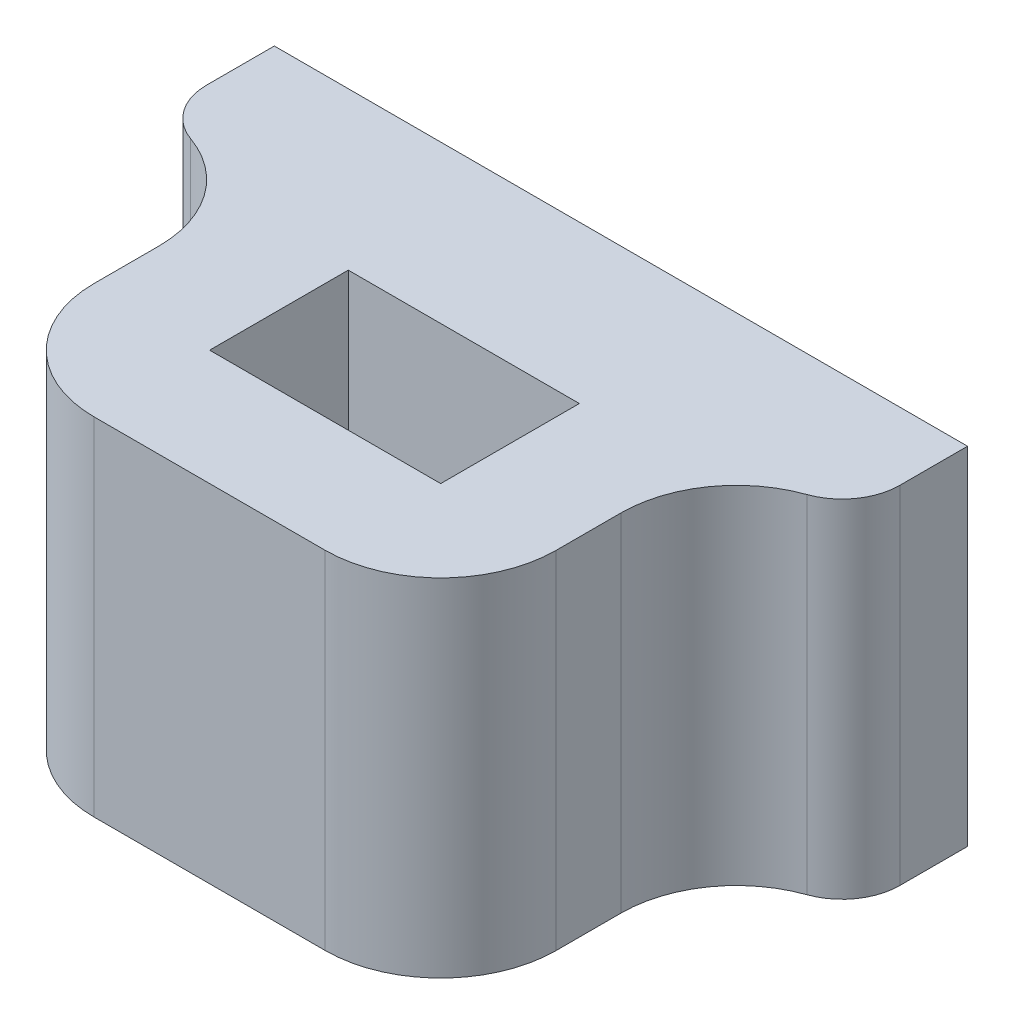
from build123d import *

# Parameters (mm, degrees)
SKETCH1_W           = 19.05
SKETCH1_H           = 9.525
BOSS_EXTRUDE1_DEPTH = 3.175
SKETCH2_W           = 12.7
SKETCH2_H           = 9.525
BOSS_EXTRUDE2_DEPTH = 8.128
SKETCH3_W           = 6.35
SKETCH3_H           = 3.81
CUT_EXTRUDE1_DEPTH  = 18.584341301
FILLET1_START       = -4.7625
FILLET1_DEPTH       = 9.525
FILLET1_2_DEPTH     = 9.525
FILLET2_R           = 1.5875


with BuildPart() as part:
    # Sketch1 → Boss-Extrude1 (new body)
    with BuildSketch(Plane.XY):
        Rectangle(SKETCH1_W, SKETCH1_H)
    extrude(amount=BOSS_EXTRUDE1_DEPTH)

    # Sketch2 → Boss-Extrude2 (add)
    with BuildSketch(Plane.XY.offset(3.175)):
        Rectangle(SKETCH2_W, SKETCH2_H)
    extrude(amount=BOSS_EXTRUDE2_DEPTH)

    # Sketch3 → Cut-Extrude1 (cut, through all)
    with BuildSketch(Plane.XZ.offset(4.7625)):
        with Locations((0, 6.223)):
            Rectangle(SKETCH3_W, SKETCH3_H)
    extrude(amount=-CUT_EXTRUDE1_DEPTH, mode=Mode.SUBTRACT)

    # Fillet1: read off the stored shape, not the designer's step
    # Fillet1 outline → Fillet1 (cut)
    with BuildSketch(Plane(origin=(0, 0, 0), x_dir=(1, 0, 0), z_dir=(0, 1, 0)).offset(FILLET1_START)):
        with BuildLine():
            ThreePointArc((6.35, -8.128), (5.42006403, -10.37306403), (3.175, -11.303))
            Line((3.175, -11.303), (6.35, -11.303))
            Line((6.35, -11.303), (6.35, -8.128))
        make_face()
        with BuildLine():
            ThreePointArc((-3.175, -11.303), (-5.42006403, -10.37306403), (-6.35, -8.128))
            Line((-6.35, -8.128), (-6.35, -11.303))
            Line((-6.35, -11.303), (-3.175, -11.303))
        make_face()
    extrude(amount=FILLET1_DEPTH, mode=Mode.SUBTRACT)

    # Fillet1 2 outline → Fillet1 2 (add)
    with BuildSketch(Plane(origin=(0, 0, 0), x_dir=(1, 0, 0), z_dir=(0, 1, 0)).offset(FILLET1_START)):
        with BuildLine():
            Line((6.35, -3.175), (6.35, -6.35))
            ThreePointArc((6.35, -6.35), (7.27993597, -4.10493597), (9.525, -3.175))
            Line((9.525, -3.175), (6.35, -3.175))
        make_face()
        with BuildLine():
            ThreePointArc((-9.525, -3.175), (-7.27993597, -4.10493597), (-6.35, -6.35))
            Line((-6.35, -6.35), (-6.35, -3.175))
            Line((-6.35, -3.175), (-9.525, -3.175))
        make_face()
    extrude(amount=FILLET1_2_DEPTH)

    # Fillet2
    fillet2_edges = [part.edges().sort_by_distance(p)[0] for p in [
        (-9.525, 0, 3.175),
        (9.525, 0, 3.175),
    ]]
    fillet(fillet2_edges, radius=FILLET2_R)


solid = part.part
